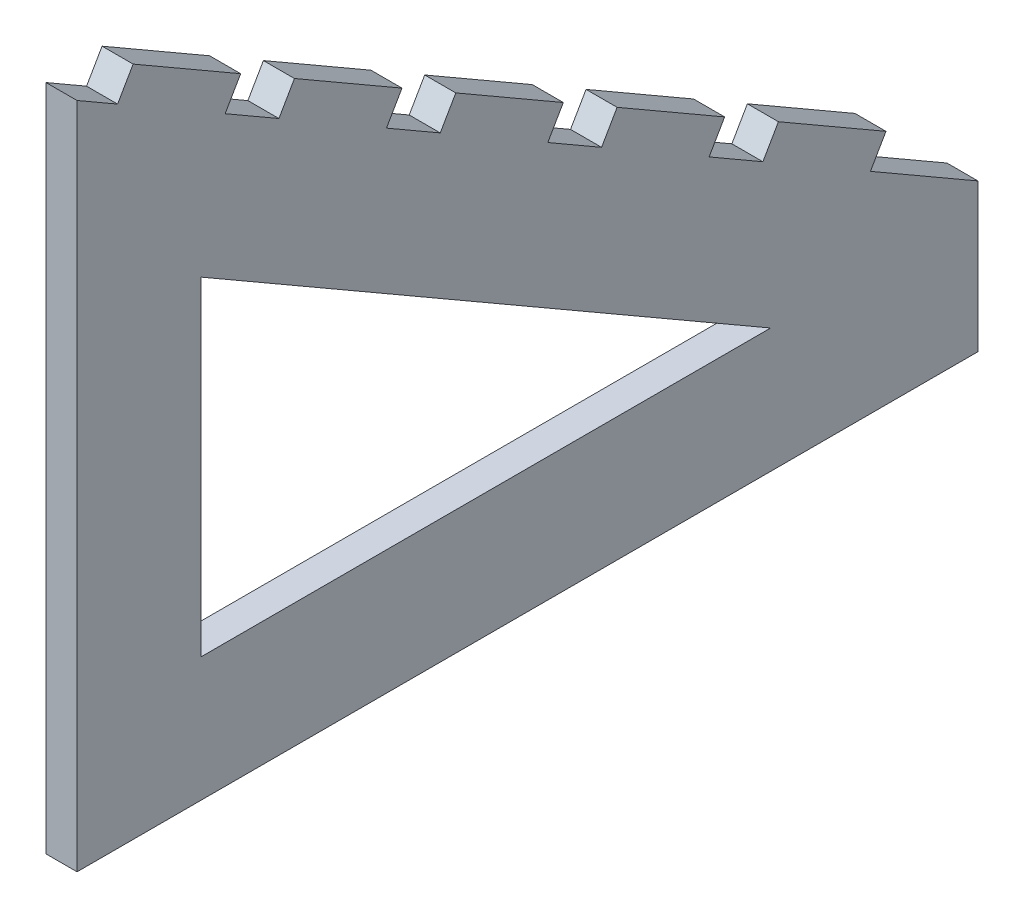
from build123d import *

# Parameters (mm, degrees)
BOSS_EXTRUDE1_DEPTH = 3.175
CUT_EXTRUDE1_DEPTH  = 6.35
SKETCH3_W           = 6.35
SKETCH3_H           = 25.4
BOSS_EXTRUDE2_DEPTH = 6.35
LPATTERN1_COUNT     = 5
LPATTERN1_PITCH     = 38.1


with BuildPart() as part:
    # Sketch1 → Boss-Extrude1 (new, symmetric)
    with BuildSketch(Plane.ZY.offset(32.038437852)):
        Polygon((-213.509598145, 95.25), (-213.509598145, 125.492599154), (-29.238522478, 231.881554295), (-29.238522478, 95.25), align=None)
    extrude(amount=BOSS_EXTRUDE1_DEPTH, both=True)

    # Sketch2 → Cut-Extrude1 (cut)
    with BuildSketch(Plane.ZY.offset(35.213437852)):
        Polygon((-54.638522478, 120.65), (-54.638522478, 187.887463782), (-171.097225921, 120.65), align=None)
    extrude(amount=-CUT_EXTRUDE1_DEPTH, mode=Mode.SUBTRACT)

    # Sketch3 → Boss-Extrude2 (add)
    with BuildSketch(Plane(origin=(0, 186.571817339, -107.717288964), x_dir=(1, 0, 0), z_dir=(0, 0.8660254037844386, -0.5000000000000002))):
        with Locations((-32.038437852, 84.058436368)):
            Rectangle(SKETCH3_W, SKETCH3_H)
    boss_extrude2 = extrude(amount=BOSS_EXTRUDE2_DEPTH)

    # LPattern1: Boss-Extrude2 ×5
    with Locations(*[Vector(0, 0.5000000000000003, 0.8660254037844386) * (i * LPATTERN1_PITCH) for i in range(1, LPATTERN1_COUNT)]):
        add(boss_extrude2)


solid = part.part
